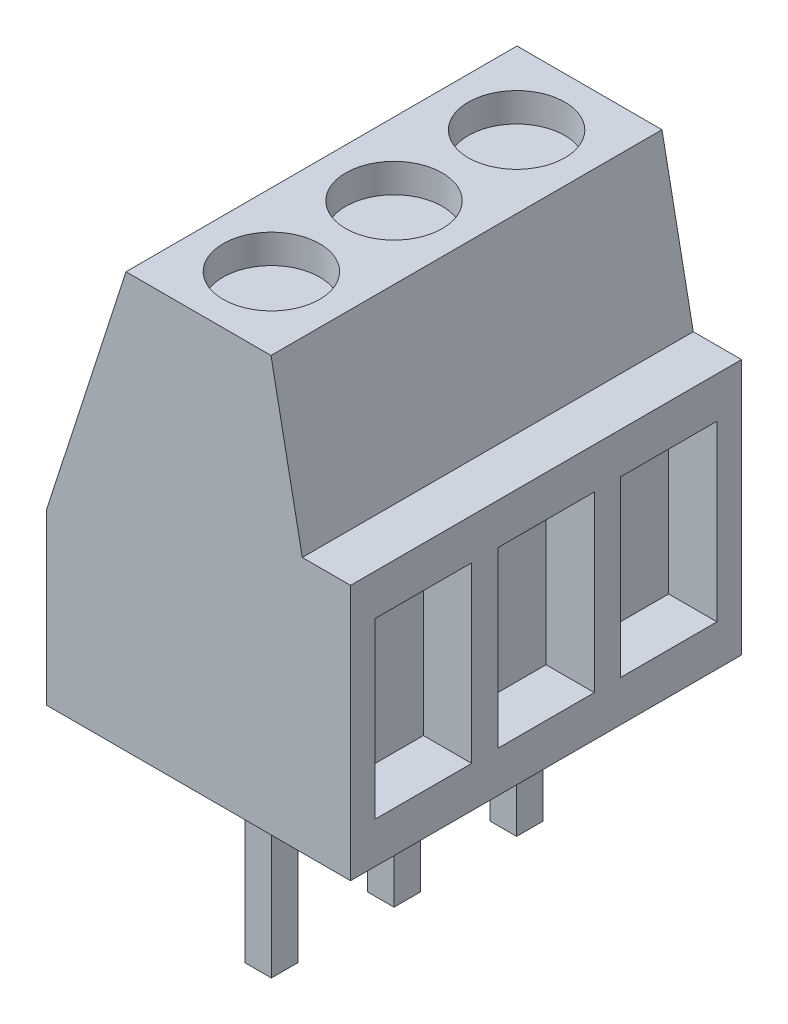
from build123d import *

# Parameters (mm, degrees)
BOSS_EXTRUDE1_DEPTH   = 8.1
SKETCH3_R             = 1
CUT_EXTRUDE1_DEPTH    = 0.6
SKETCH4_W             = 2
SKETCH4_H             = 3.6
CUT_EXTRUDE2_DEPTH    = 1
SKETCH5_W             = 0.55
SKETCH5_H             = 0.55
BOSS_EXTRUDE2_DEPTH   = 3.8
LPATTERN1_START       = 2.875
LPATTERN1_OUTLINE_W   = 3.8
LPATTERN1_OUTLINE_H   = 0.55
LPATTERN1_DEPTH       = 0.55
LPATTERN1_2_OUTLINE_W = 3.8
LPATTERN1_2_OUTLINE_H = 0.55
LPATTERN1_2_DEPTH     = 0.55
LPATTERN1_START_2     = 0.85
LPATTERN1_3_OUTLINE_W = 1
LPATTERN1_3_OUTLINE_H = 2
LPATTERN1_3_DEPTH     = 3.6
LPATTERN1_START_3     = 8
LPATTERN1_4_OUTLINE_R = 1
LPATTERN1_4_DEPTH     = 0.6


# Read off the part's stored shape, not the designer's step: LPattern1
with BuildPart() as part:
    # Sketch2 → Boss-Extrude1 (new body)
    with BuildSketch(Plane.XY):
        Polygon((6.3, 5.3), (5.3, 5.3), (4.652088092, 8.6), (1.647911908, 8.6), (0, 3.5), (0, 0), (6.3, 0), align=None)
    extrude(amount=-BOSS_EXTRUDE1_DEPTH)

    # Sketch3 → Cut-Extrude1 (cut)
    with BuildSketch(Plane(origin=(0, 8.6, 0), x_dir=(1, 0, 0), z_dir=(0, 1, 0))):
        with Locations(Location((3.15, 1.51, 0), (0, 0, 270))):
            Circle(SKETCH3_R)
    extrude(amount=-CUT_EXTRUDE1_DEPTH, mode=Mode.SUBTRACT)

    # Sketch4 → Cut-Extrude2 (cut)
    with BuildSketch(Plane(origin=(6.3, 0, 0), x_dir=(0, 0, -1), z_dir=(1, 0, 0))):
        with Locations((1.51, 2.65)):
            Rectangle(SKETCH4_W, SKETCH4_H)
    extrude(amount=-CUT_EXTRUDE2_DEPTH, mode=Mode.SUBTRACT)

    # LPattern1 3 outline → LPattern1 3 (cut)
    with BuildSketch(Plane(origin=(0, 0, 0), x_dir=(1, 0, 0), z_dir=(0, 1, 0)).offset(LPATTERN1_START_2)):
        with Locations((5.8, 6.59)):
            Rectangle(LPATTERN1_3_OUTLINE_W, LPATTERN1_3_OUTLINE_H)
        with Locations((5.8, 4.05)):
            Rectangle(LPATTERN1_3_OUTLINE_W, LPATTERN1_3_OUTLINE_H)
    extrude(amount=LPATTERN1_3_DEPTH, mode=Mode.SUBTRACT)

    # LPattern1 4 outline → LPattern1 4 (cut)
    with BuildSketch(Plane(origin=(0, 0, 0), x_dir=(1, 0, 0), z_dir=(0, 1, 0)).offset(LPATTERN1_START_3)):
        with Locations((3.15, 6.59)):
            Circle(LPATTERN1_4_OUTLINE_R)
        with Locations((3.15, 4.05)):
            Circle(LPATTERN1_4_OUTLINE_R)
    extrude(amount=LPATTERN1_4_DEPTH, mode=Mode.SUBTRACT)


with BuildPart() as body_2:
    # Sketch5 → Boss-Extrude2 (new body)
    with BuildSketch(Plane.XZ):
        with Locations((3.15, -1.51)):
            Rectangle(SKETCH5_W, SKETCH5_H)
    extrude(amount=BOSS_EXTRUDE2_DEPTH)


with BuildPart() as body_3:
    # LPattern1 outline → LPattern1 (new body)
    with BuildSketch(Plane.YZ.offset(LPATTERN1_START)):
        with Locations((-1.9, -6.59)):
            Rectangle(LPATTERN1_OUTLINE_W, LPATTERN1_OUTLINE_H)
    extrude(amount=LPATTERN1_DEPTH)


with BuildPart() as body_4:
    # LPattern1 2 outline → LPattern1 2 (new body)
    with BuildSketch(Plane.YZ.offset(LPATTERN1_START)):
        with Locations((-1.9, -4.05)):
            Rectangle(LPATTERN1_2_OUTLINE_W, LPATTERN1_2_OUTLINE_H)
    extrude(amount=LPATTERN1_2_DEPTH)


solid = Compound([part.part, body_2.part, body_3.part, body_4.part])
